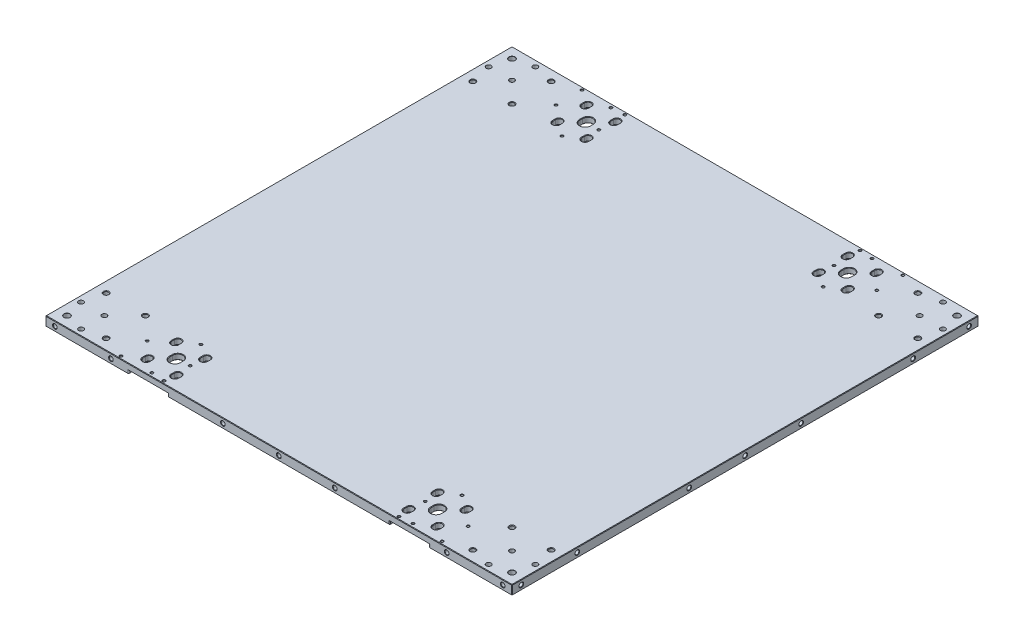
from build123d import *

# Parameters (mm, degrees)
SKETCH1_W                       = 500
SKETCH1_H                       = 500
BOSS_EXTRUDE1_DEPTH             = 10
M3X0_5_TAPPED_HOLE1_AT_2_COUNT  = 2
M3X0_5_TAPPED_HOLE1_AT_2_PITCH  = 46
M3X0_5_TAPPED_HOLE1_AT_3_COUNT  = 2
M3X0_5_TAPPED_HOLE1_AT_3_PITCH  = 53.851648071
M3X0_5_TAPPED_HOLE1_AT_4_COUNT  = 2
M3X0_5_TAPPED_HOLE1_AT_4_PITCH  = 28
M3X0_5_TAPPED_HOLE1_AT_5_COUNT  = 2
M3X0_5_TAPPED_HOLE1_AT_5_PITCH  = 298
M3X0_5_TAPPED_HOLE1_AT_6_COUNT  = 2
M3X0_5_TAPPED_HOLE1_AT_6_PITCH  = 344
M3X0_5_TAPPED_HOLE1_AT_7_COUNT  = 2
M3X0_5_TAPPED_HOLE1_AT_7_PITCH  = 345.137653698
M3X0_5_TAPPED_HOLE1_AT_8_COUNT  = 2
M3X0_5_TAPPED_HOLE1_AT_8_PITCH  = 299.312545678
M3X0_5_TAPPED_HOLE1_AT_9_COUNT  = 2
M3X0_5_TAPPED_HOLE1_AT_9_PITCH  = 553.13651118
M3X0_5_TAPPED_HOLE1_AT_10_COUNT = 2
M3X0_5_TAPPED_HOLE1_AT_10_PITCH = 579.216712466
M3X0_5_TAPPED_HOLE1_AT_11_COUNT = 2
M3X0_5_TAPPED_HOLE1_AT_11_PITCH = 556.938057597
M3X0_5_TAPPED_HOLE1_AT_12_COUNT = 2
M3X0_5_TAPPED_HOLE1_AT_12_PITCH = 529.762210808
M3X0_5_TAPPED_HOLE1_AT_13_COUNT = 2
M3X0_5_TAPPED_HOLE1_AT_13_PITCH = 468.264882305
M3X0_5_TAPPED_HOLE1_AT_14_COUNT = 2
M3X0_5_TAPPED_HOLE1_AT_14_PITCH = 466
M3X0_5_TAPPED_HOLE1_AT_15_COUNT = 2
M3X0_5_TAPPED_HOLE1_AT_15_PITCH = 438
M3X0_5_TAPPED_HOLE1_AT_16_COUNT = 2
M3X0_5_TAPPED_HOLE1_AT_16_PITCH = 440.408900909
M6X1_0_TAPPED_HOLE1_AT_2_COUNT  = 2
M6X1_0_TAPPED_HOLE1_AT_2_PITCH  = 42
M6X1_0_TAPPED_HOLE1_AT_3_COUNT  = 2
M6X1_0_TAPPED_HOLE1_AT_3_PITCH  = 59.39696962
M5X0_8_TAPPED_HOLE1_AT_2_COUNT  = 2
M5X0_8_TAPPED_HOLE1_AT_2_PITCH  = 480
M5X0_8_TAPPED_HOLE1_AT_3_COUNT  = 2
M5X0_8_TAPPED_HOLE1_AT_3_PITCH  = 420
M5X0_8_TAPPED_HOLE1_AT_4_COUNT  = 2
M5X0_8_TAPPED_HOLE1_AT_4_PITCH  = 300
M5X0_8_TAPPED_HOLE1_AT_5_COUNT  = 2
M5X0_8_TAPPED_HOLE1_AT_5_PITCH  = 240
M5X0_8_TAPPED_HOLE1_AT_6_COUNT  = 2
M5X0_8_TAPPED_HOLE1_AT_6_PITCH  = 180
M5X0_8_TAPPED_HOLE1_AT_7_COUNT  = 2
M5X0_8_TAPPED_HOLE1_AT_7_PITCH  = 60
CBORE_FOR_M5_SHCS1_AT_2_COUNT   = 2
CBORE_FOR_M5_SHCS1_AT_2_PITCH   = 35.355339059
CBORE_FOR_M5_SHCS1_AT_3_COUNT   = 2
CBORE_FOR_M5_SHCS1_AT_3_PITCH   = 25
CIRPATTERN1_COUNT               = 4
F_11_0_11_DIAMETER_SLOT1_DEPTH  = 10
F_7_0_7_DIAMETER_SLOT1_DEPTH    = 10
SKETCH16_W                      = 42
SKETCH16_H                      = 65.2
CUT_EXTRUDE1_DEPTH              = 4
M3X0_5_TAPPED_HOLE2_AT_2_COUNT  = 2
M3X0_5_TAPPED_HOLE2_AT_2_PITCH  = 26.25
M3X0_5_TAPPED_HOLE2_AT_3_COUNT  = 2
M3X0_5_TAPPED_HOLE2_AT_3_PITCH  = 26.25
MIRROR2_COPY_3_DEPTH            = 10
MIRROR2_COPY_4_DEPTH            = 10
MIRROR2_COPY_5_SKETCH_W         = 42
MIRROR2_COPY_5_SKETCH_H         = 65.2
MIRROR2_COPY_5_DEPTH            = 4
FILLET2_R                       = 4
FILLET3_R                       = 1
CHAMFER1_SIZE                   = 0.5


# Read off the part's stored shape, not the designer's step: Ø11.0 (11) Diameter Slot1, Ø7.0 (7) Diameter Slot1
with BuildPart() as part:
    # Sketch1 → Boss-Extrude1 (new body)
    with BuildSketch(Plane(origin=(0, 0, 0), x_dir=(1, 0, 0), z_dir=(0, 1, 0))):
        Rectangle(SKETCH1_W, SKETCH1_H)
    extrude(amount=BOSS_EXTRUDE1_DEPTH)

    # Sketch8 → M3x0.5 Tapped Hole1 (revolve, cut)
    with BuildSketch(Plane(origin=(172, 10, 219), x_dir=(0, 0, 1), z_dir=(1, 0, 0))):
        Polygon((0, 0), (0, 10), (1.525, 10), (1.25, 9.725), (1.25, 0.275), (1.525, 0), align=None)
    m3x0_5_tapped_hole1 = revolve(axis=Axis((172, 16.35, 219), (0, -1, 0)), mode=Mode.SUBTRACT)

    # M3x0.5 Tapped Hole1 at 2: M3x0.5 Tapped Hole1 ×2
    with Locations(*[(-i * M3X0_5_TAPPED_HOLE1_AT_2_PITCH, 0, 0) for i in range(1, M3X0_5_TAPPED_HOLE1_AT_2_COUNT)]):
        add(m3x0_5_tapped_hole1, mode=Mode.SUBTRACT)

    # M3x0.5 Tapped Hole1 at 3: M3x0.5 Tapped Hole1 ×2
    with Locations(*[Vector(-0.8541985556144385, 0, 0.5199469468957455) * (i * M3X0_5_TAPPED_HOLE1_AT_3_PITCH) for i in range(1, M3X0_5_TAPPED_HOLE1_AT_3_COUNT)]):
        add(m3x0_5_tapped_hole1, mode=Mode.SUBTRACT)

    # M3x0.5 Tapped Hole1 at 4: M3x0.5 Tapped Hole1 ×2
    with Locations(*[(0, 0, i * M3X0_5_TAPPED_HOLE1_AT_4_PITCH) for i in range(1, M3X0_5_TAPPED_HOLE1_AT_4_COUNT)]):
        add(m3x0_5_tapped_hole1, mode=Mode.SUBTRACT)

    # M3x0.5 Tapped Hole1 at 5: M3x0.5 Tapped Hole1 ×2
    with Locations(*[(-i * M3X0_5_TAPPED_HOLE1_AT_5_PITCH, 0, 0) for i in range(1, M3X0_5_TAPPED_HOLE1_AT_5_COUNT)]):
        add(m3x0_5_tapped_hole1, mode=Mode.SUBTRACT)

    # M3x0.5 Tapped Hole1 at 6: M3x0.5 Tapped Hole1 ×2
    with Locations(*[(-i * M3X0_5_TAPPED_HOLE1_AT_6_PITCH, 0, 0) for i in range(1, M3X0_5_TAPPED_HOLE1_AT_6_COUNT)]):
        add(m3x0_5_tapped_hole1, mode=Mode.SUBTRACT)

    # M3x0.5 Tapped Hole1 at 7: M3x0.5 Tapped Hole1 ×2
    with Locations(*[Vector(-0.9967037682339824, 0, 0.081127050902766) * (i * M3X0_5_TAPPED_HOLE1_AT_7_PITCH) for i in range(1, M3X0_5_TAPPED_HOLE1_AT_7_COUNT)]):
        add(m3x0_5_tapped_hole1, mode=Mode.SUBTRACT)

    # M3x0.5 Tapped Hole1 at 8: M3x0.5 Tapped Hole1 ×2
    with Locations(*[Vector(-0.995614798990067, 0, 0.09354769923396598) * (i * M3X0_5_TAPPED_HOLE1_AT_8_PITCH) for i in range(1, M3X0_5_TAPPED_HOLE1_AT_8_COUNT)]):
        add(m3x0_5_tapped_hole1, mode=Mode.SUBTRACT)

    # M3x0.5 Tapped Hole1 at 9: M3x0.5 Tapped Hole1 ×2
    with Locations(*[Vector(-0.5387458502142013, 0, -0.8424683429524088) * (i * M3X0_5_TAPPED_HOLE1_AT_9_PITCH) for i in range(1, M3X0_5_TAPPED_HOLE1_AT_9_COUNT)]):
        add(m3x0_5_tapped_hole1, mode=Mode.SUBTRACT)

    # M3x0.5 Tapped Hole1 at 10: M3x0.5 Tapped Hole1 ×2
    with Locations(*[Vector(-0.5939055151488782, 0, -0.8045347966842364) * (i * M3X0_5_TAPPED_HOLE1_AT_10_PITCH) for i in range(1, M3X0_5_TAPPED_HOLE1_AT_10_COUNT)]):
        add(m3x0_5_tapped_hole1, mode=Mode.SUBTRACT)

    # M3x0.5 Tapped Hole1 at 11: M3x0.5 Tapped Hole1 ×2
    with Locations(*[Vector(-0.6176629434953669, 0, -0.7864429338691011) * (i * M3X0_5_TAPPED_HOLE1_AT_11_PITCH) for i in range(1, M3X0_5_TAPPED_HOLE1_AT_11_COUNT)]):
        add(m3x0_5_tapped_hole1, mode=Mode.SUBTRACT)

    # M3x0.5 Tapped Hole1 at 12: M3x0.5 Tapped Hole1 ×2
    with Locations(*[Vector(-0.5625165289641595, 0, -0.8267860392157781) * (i * M3X0_5_TAPPED_HOLE1_AT_12_PITCH) for i in range(1, M3X0_5_TAPPED_HOLE1_AT_12_COUNT)]):
        add(m3x0_5_tapped_hole1, mode=Mode.SUBTRACT)

    # M3x0.5 Tapped Hole1 at 13: M3x0.5 Tapped Hole1 ×2
    with Locations(*[Vector(-0.09823499847688853, 0, -0.995163245439785) * (i * M3X0_5_TAPPED_HOLE1_AT_13_PITCH) for i in range(1, M3X0_5_TAPPED_HOLE1_AT_13_COUNT)]):
        add(m3x0_5_tapped_hole1, mode=Mode.SUBTRACT)

    # M3x0.5 Tapped Hole1 at 14: M3x0.5 Tapped Hole1 ×2
    with Locations(*[(0, 0, -i * M3X0_5_TAPPED_HOLE1_AT_14_PITCH) for i in range(1, M3X0_5_TAPPED_HOLE1_AT_14_COUNT)]):
        add(m3x0_5_tapped_hole1, mode=Mode.SUBTRACT)

    # M3x0.5 Tapped Hole1 at 15: M3x0.5 Tapped Hole1 ×2
    with Locations(*[(0, 0, -i * M3X0_5_TAPPED_HOLE1_AT_15_PITCH) for i in range(1, M3X0_5_TAPPED_HOLE1_AT_15_COUNT)]):
        add(m3x0_5_tapped_hole1, mode=Mode.SUBTRACT)

    # M3x0.5 Tapped Hole1 at 16: M3x0.5 Tapped Hole1 ×2
    with Locations(*[Vector(-0.10444838854310472, 0, -0.9945303083017374) * (i * M3X0_5_TAPPED_HOLE1_AT_16_PITCH) for i in range(1, M3X0_5_TAPPED_HOLE1_AT_16_COUNT)]):
        add(m3x0_5_tapped_hole1, mode=Mode.SUBTRACT)

    # Sketch6 → M6x1.0 Tapped Hole1 (revolve, cut)
    with BuildSketch(Plane(origin=(196.5, 10, 238.5), x_dir=(0, 0, 1), z_dir=(1, 0, 0))):
        Polygon((0, 0), (0, 10), (3.025, 10), (2.5, 9.475), (2.5, 0.525), (3.025, 0), align=None)
    m6x1_0_tapped_hole1 = revolve(axis=Axis((196.5, 16.35, 238.5), (0, -1, 0)), mode=Mode.SUBTRACT)

    # M6x1.0 Tapped Hole1 at 2: M6x1.0 Tapped Hole1 ×2
    with Locations(*[(0, 0, -i * M6X1_0_TAPPED_HOLE1_AT_2_PITCH) for i in range(1, M6X1_0_TAPPED_HOLE1_AT_2_COUNT)]):
        add(m6x1_0_tapped_hole1, mode=Mode.SUBTRACT)

    # M6x1.0 Tapped Hole1 at 3: M6x1.0 Tapped Hole1 ×2
    with Locations(*[Vector(0.7071067811865474, 0, -0.7071067811865478) * (i * M6X1_0_TAPPED_HOLE1_AT_3_PITCH) for i in range(1, M6X1_0_TAPPED_HOLE1_AT_3_COUNT)]):
        add(m6x1_0_tapped_hole1, mode=Mode.SUBTRACT)

    # Sketch23 → M6 Clearance Hole1 (revolve, cut)
    with BuildSketch(Plane(origin=(238.5, 10, 238.5), x_dir=(0, 0, 1), z_dir=(1, 0, 0))):
        Polygon((0, 0), (0, 10), (3.325, 10), (3.2, 9.875), (3.2, 0.125), (3.325, 0), align=None)
    m6_clearance_hole1 = revolve(axis=Axis((238.5, 16.35, 238.5), (0, -1, 0)), mode=Mode.SUBTRACT)

    # Sketch21 → M5x0.8 Tapped Hole1 (revolve, cut)
    with BuildSketch(Plane(origin=(240, 5, 250), x_dir=(0, -1, 0), z_dir=(1, 0, 0))):
        Polygon((0, 0), (0, 8.6618073), (2.1, 7.4), (2.1, 0.425), (2.525, 0), align=None)
    m5x0_8_tapped_hole1 = revolve(axis=Axis((240, 5, 256.35), (0, 0, -1)), mode=Mode.SUBTRACT)

    # M5x0.8 Tapped Hole1 at 2: M5x0.8 Tapped Hole1 ×2
    with Locations(*[(-i * M5X0_8_TAPPED_HOLE1_AT_2_PITCH, 0, 0) for i in range(1, M5X0_8_TAPPED_HOLE1_AT_2_COUNT)]):
        add(m5x0_8_tapped_hole1, mode=Mode.SUBTRACT)

    # M5x0.8 Tapped Hole1 at 3: M5x0.8 Tapped Hole1 ×2
    with Locations(*[(-i * M5X0_8_TAPPED_HOLE1_AT_3_PITCH, 0, 0) for i in range(1, M5X0_8_TAPPED_HOLE1_AT_3_COUNT)]):
        add(m5x0_8_tapped_hole1, mode=Mode.SUBTRACT)

    # M5x0.8 Tapped Hole1 at 4: M5x0.8 Tapped Hole1 ×2
    with Locations(*[(-i * M5X0_8_TAPPED_HOLE1_AT_4_PITCH, 0, 0) for i in range(1, M5X0_8_TAPPED_HOLE1_AT_4_COUNT)]):
        add(m5x0_8_tapped_hole1, mode=Mode.SUBTRACT)

    # M5x0.8 Tapped Hole1 at 5: M5x0.8 Tapped Hole1 ×2
    with Locations(*[(-i * M5X0_8_TAPPED_HOLE1_AT_5_PITCH, 0, 0) for i in range(1, M5X0_8_TAPPED_HOLE1_AT_5_COUNT)]):
        add(m5x0_8_tapped_hole1, mode=Mode.SUBTRACT)

    # M5x0.8 Tapped Hole1 at 6: M5x0.8 Tapped Hole1 ×2
    with Locations(*[(-i * M5X0_8_TAPPED_HOLE1_AT_6_PITCH, 0, 0) for i in range(1, M5X0_8_TAPPED_HOLE1_AT_6_COUNT)]):
        add(m5x0_8_tapped_hole1, mode=Mode.SUBTRACT)

    # M5x0.8 Tapped Hole1 at 7: M5x0.8 Tapped Hole1 ×2
    with Locations(*[(-i * M5X0_8_TAPPED_HOLE1_AT_7_PITCH, 0, 0) for i in range(1, M5X0_8_TAPPED_HOLE1_AT_7_COUNT)]):
        add(m5x0_8_tapped_hole1, mode=Mode.SUBTRACT)

    # Sketch25 → CBORE for M5 SHCS1 (revolve, cut)
    with BuildSketch(Plane(origin=(243.45, 0, 218.45), x_dir=(0, 0, -1), z_dir=(1, 0, 0))):
        Polygon((0, 0), (0, 10), (2.65, 10), (2.65, 5), (5, 5), (5, 0.5), (5.5, 0), align=None)
    cbore_for_m5_shcs1 = revolve(axis=Axis((243.45, -6.35, 218.45), (0, 1, 0)), mode=Mode.SUBTRACT)

    # CBORE for M5 SHCS1 at 2: CBORE for M5 SHCS1 ×2
    with Locations(*[Vector(-0.7071067811865476, 0, 0.7071067811865476) * (i * CBORE_FOR_M5_SHCS1_AT_2_PITCH) for i in range(1, CBORE_FOR_M5_SHCS1_AT_2_COUNT)]):
        add(cbore_for_m5_shcs1, mode=Mode.SUBTRACT)

    # CBORE for M5 SHCS1 at 3: CBORE for M5 SHCS1 ×2
    with Locations(*[(-i * CBORE_FOR_M5_SHCS1_AT_3_PITCH, 0, 0) for i in range(1, CBORE_FOR_M5_SHCS1_AT_3_COUNT)]):
        add(cbore_for_m5_shcs1, mode=Mode.SUBTRACT)

    # CirPattern1: M6x1.0 Tapped Hole1, M6 Clearance Hole1, M5x0.8 Tapped Hole1, CBORE for M5 SHCS1 ×4 about axis
    cirpattern1_axis = Axis((0, 0, 0), (0, 1, 0))
    add([m6x1_0_tapped_hole1.rotate(cirpattern1_axis, i * 360 / CIRPATTERN1_COUNT) for i in range(1, CIRPATTERN1_COUNT)], mode=Mode.SUBTRACT)
    add([m6_clearance_hole1.rotate(cirpattern1_axis, i * 360 / CIRPATTERN1_COUNT) for i in range(1, CIRPATTERN1_COUNT)], mode=Mode.SUBTRACT)
    add([m5x0_8_tapped_hole1.rotate(cirpattern1_axis, i * 360 / CIRPATTERN1_COUNT) for i in range(1, CIRPATTERN1_COUNT)], mode=Mode.SUBTRACT)
    add([cbore_for_m5_shcs1.rotate(cirpattern1_axis, i * 360 / CIRPATTERN1_COUNT) for i in range(1, CIRPATTERN1_COUNT)], mode=Mode.SUBTRACT)

    # CirPattern1 copy 1 sketch → CirPattern1 copy 1 (revolve, cut)
    with BuildSketch(Plane(origin=(196.5, 10, -196.5), x_dir=(1, 0, 0), z_dir=(0, 0, -1))):
        Polygon((0, 0), (0, 10), (3.025, 10), (2.5, 9.475), (2.5, 0.525), (3.025, 0), align=None)
    revolve(axis=Axis((196.5, 16.35, -196.5), (0, -1, 0)), mode=Mode.SUBTRACT)

    # CirPattern1 copy 2 sketch → CirPattern1 copy 2 (revolve, cut)
    with BuildSketch(Plane(origin=(-196.5, 10, -196.5), x_dir=(0, 0, -1), z_dir=(-1, 0, 0))):
        Polygon((0, 0), (0, 10), (3.025, 10), (2.5, 9.475), (2.5, 0.525), (3.025, 0), align=None)
    revolve(axis=Axis((-196.5, 16.35, -196.5), (0, -1, 0)), mode=Mode.SUBTRACT)

    # CirPattern1 copy 3 sketch → CirPattern1 copy 3 (revolve, cut)
    with BuildSketch(Plane(origin=(-196.5, 10, 196.5), x_dir=(-1, 0, 0), z_dir=(0, 0, 1))):
        Polygon((0, 0), (0, 10), (3.025, 10), (2.5, 9.475), (2.5, 0.525), (3.025, 0), align=None)
    revolve(axis=Axis((-196.5, 16.35, 196.5), (0, -1, 0)), mode=Mode.SUBTRACT)

    # CirPattern1 copy 4 sketch → CirPattern1 copy 4 (revolve, cut)
    with BuildSketch(Plane(origin=(196.5, 10, -238.5), x_dir=(1, 0, 0), z_dir=(0, 0, -1))):
        Polygon((0, 0), (0, 10), (3.025, 10), (2.5, 9.475), (2.5, 0.525), (3.025, 0), align=None)
    revolve(axis=Axis((196.5, 16.35, -238.5), (0, -1, 0)), mode=Mode.SUBTRACT)

    # CirPattern1 copy 5 sketch → CirPattern1 copy 5 (revolve, cut)
    with BuildSketch(Plane(origin=(-238.5, 10, -196.5), x_dir=(0, 0, -1), z_dir=(-1, 0, 0))):
        Polygon((0, 0), (0, 10), (3.025, 10), (2.5, 9.475), (2.5, 0.525), (3.025, 0), align=None)
    revolve(axis=Axis((-238.5, 16.35, -196.5), (0, -1, 0)), mode=Mode.SUBTRACT)

    # CirPattern1 copy 6 sketch → CirPattern1 copy 6 (revolve, cut)
    with BuildSketch(Plane(origin=(-196.5, 10, 238.5), x_dir=(-1, 0, 0), z_dir=(0, 0, 1))):
        Polygon((0, 0), (0, 10), (3.025, 10), (2.5, 9.475), (2.5, 0.525), (3.025, 0), align=None)
    revolve(axis=Axis((-196.5, 16.35, 238.5), (0, -1, 0)), mode=Mode.SUBTRACT)

    # CirPattern1 copy 7 sketch → CirPattern1 copy 7 (revolve, cut)
    with BuildSketch(Plane(origin=(250, 5, 240), x_dir=(0, -1, 0), z_dir=(0, 0, -1))):
        Polygon((0, 0), (0, 8.6618073), (2.1, 7.4), (2.1, 0.425), (2.525, 0), align=None)
    revolve(axis=Axis((256.35, 5, 240), (-1, 0, 0)), mode=Mode.SUBTRACT)

    # CirPattern1 copy 8 sketch → CirPattern1 copy 8 (revolve, cut)
    with BuildSketch(Plane(origin=(240, 5, -250), x_dir=(0, -1, 0), z_dir=(-1, 0, 0))):
        Polygon((0, 0), (0, 8.6618073), (2.1, 7.4), (2.1, 0.425), (2.525, 0), align=None)
    revolve(axis=Axis((240, 5, -256.35), (0, 0, 1)), mode=Mode.SUBTRACT)

    # CirPattern1 copy 9 sketch → CirPattern1 copy 9 (revolve, cut)
    with BuildSketch(Plane(origin=(-250, 5, -240), x_dir=(0, -1, 0), z_dir=(0, 0, 1))):
        Polygon((0, 0), (0, 8.6618073), (2.1, 7.4), (2.1, 0.425), (2.525, 0), align=None)
    revolve(axis=Axis((-256.35, 5, -240), (1, 0, 0)), mode=Mode.SUBTRACT)

    # CirPattern1 copy 10 sketch → CirPattern1 copy 10 (revolve, cut)
    with BuildSketch(Plane(origin=(250, 5, 180), x_dir=(0, -1, 0), z_dir=(0, 0, -1))):
        Polygon((0, 0), (0, 8.6618073), (2.1, 7.4), (2.1, 0.425), (2.525, 0), align=None)
    revolve(axis=Axis((256.35, 5, 180), (-1, 0, 0)), mode=Mode.SUBTRACT)

    # CirPattern1 copy 11 sketch → CirPattern1 copy 11 (revolve, cut)
    with BuildSketch(Plane(origin=(180, 5, -250), x_dir=(0, -1, 0), z_dir=(-1, 0, 0))):
        Polygon((0, 0), (0, 8.6618073), (2.1, 7.4), (2.1, 0.425), (2.525, 0), align=None)
    revolve(axis=Axis((180, 5, -256.35), (0, 0, 1)), mode=Mode.SUBTRACT)

    # CirPattern1 copy 12 sketch → CirPattern1 copy 12 (revolve, cut)
    with BuildSketch(Plane(origin=(-250, 5, -180), x_dir=(0, -1, 0), z_dir=(0, 0, 1))):
        Polygon((0, 0), (0, 8.6618073), (2.1, 7.4), (2.1, 0.425), (2.525, 0), align=None)
    revolve(axis=Axis((-256.35, 5, -180), (1, 0, 0)), mode=Mode.SUBTRACT)

    # CirPattern1 copy 13 sketch → CirPattern1 copy 13 (revolve, cut)
    with BuildSketch(Plane(origin=(250, 5, 60), x_dir=(0, -1, 0), z_dir=(0, 0, -1))):
        Polygon((0, 0), (0, 8.6618073), (2.1, 7.4), (2.1, 0.425), (2.525, 0), align=None)
    revolve(axis=Axis((256.35, 5, 60), (-1, 0, 0)), mode=Mode.SUBTRACT)

    # CirPattern1 copy 14 sketch → CirPattern1 copy 14 (revolve, cut)
    with BuildSketch(Plane(origin=(60, 5, -250), x_dir=(0, -1, 0), z_dir=(-1, 0, 0))):
        Polygon((0, 0), (0, 8.6618073), (2.1, 7.4), (2.1, 0.425), (2.525, 0), align=None)
    revolve(axis=Axis((60, 5, -256.35), (0, 0, 1)), mode=Mode.SUBTRACT)

    # CirPattern1 copy 15 sketch → CirPattern1 copy 15 (revolve, cut)
    with BuildSketch(Plane(origin=(-250, 5, -60), x_dir=(0, -1, 0), z_dir=(0, 0, 1))):
        Polygon((0, 0), (0, 8.6618073), (2.1, 7.4), (2.1, 0.425), (2.525, 0), align=None)
    revolve(axis=Axis((-256.35, 5, -60), (1, 0, 0)), mode=Mode.SUBTRACT)

    # CirPattern1 copy 16 sketch → CirPattern1 copy 16 (revolve, cut)
    with BuildSketch(Plane(origin=(250, 5, 0), x_dir=(0, -1, 0), z_dir=(0, 0, -1))):
        Polygon((0, 0), (0, 8.6618073), (2.1, 7.4), (2.1, 0.425), (2.525, 0), align=None)
    revolve(axis=Axis((256.35, 5, 0), (-1, 0, 0)), mode=Mode.SUBTRACT)

    # CirPattern1 copy 17 sketch → CirPattern1 copy 17 (revolve, cut)
    with BuildSketch(Plane(origin=(0, 5, -250), x_dir=(0, -1, 0), z_dir=(-1, 0, 0))):
        Polygon((0, 0), (0, 8.6618073), (2.1, 7.4), (2.1, 0.425), (2.525, 0), align=None)
    revolve(axis=Axis((0, 5, -256.35), (0, 0, 1)), mode=Mode.SUBTRACT)

    # CirPattern1 copy 18 sketch → CirPattern1 copy 18 (revolve, cut)
    with BuildSketch(Plane(origin=(-250, 5, 0), x_dir=(0, -1, 0), z_dir=(0, 0, 1))):
        Polygon((0, 0), (0, 8.6618073), (2.1, 7.4), (2.1, 0.425), (2.525, 0), align=None)
    revolve(axis=Axis((-256.35, 5, 0), (1, 0, 0)), mode=Mode.SUBTRACT)

    # CirPattern1 copy 19 sketch → CirPattern1 copy 19 (revolve, cut)
    with BuildSketch(Plane(origin=(250, 5, -60), x_dir=(0, -1, 0), z_dir=(0, 0, -1))):
        Polygon((0, 0), (0, 8.6618073), (2.1, 7.4), (2.1, 0.425), (2.525, 0), align=None)
    revolve(axis=Axis((256.35, 5, -60), (-1, 0, 0)), mode=Mode.SUBTRACT)

    # CirPattern1 copy 20 sketch → CirPattern1 copy 20 (revolve, cut)
    with BuildSketch(Plane(origin=(-60, 5, -250), x_dir=(0, -1, 0), z_dir=(-1, 0, 0))):
        Polygon((0, 0), (0, 8.6618073), (2.1, 7.4), (2.1, 0.425), (2.525, 0), align=None)
    revolve(axis=Axis((-60, 5, -256.35), (0, 0, 1)), mode=Mode.SUBTRACT)

    # CirPattern1 copy 21 sketch → CirPattern1 copy 21 (revolve, cut)
    with BuildSketch(Plane(origin=(-250, 5, 60), x_dir=(0, -1, 0), z_dir=(0, 0, 1))):
        Polygon((0, 0), (0, 8.6618073), (2.1, 7.4), (2.1, 0.425), (2.525, 0), align=None)
    revolve(axis=Axis((-256.35, 5, 60), (1, 0, 0)), mode=Mode.SUBTRACT)

    # CirPattern1 copy 22 sketch → CirPattern1 copy 22 (revolve, cut)
    with BuildSketch(Plane(origin=(250, 5, -180), x_dir=(0, -1, 0), z_dir=(0, 0, -1))):
        Polygon((0, 0), (0, 8.6618073), (2.1, 7.4), (2.1, 0.425), (2.525, 0), align=None)
    revolve(axis=Axis((256.35, 5, -180), (-1, 0, 0)), mode=Mode.SUBTRACT)

    # CirPattern1 copy 23 sketch → CirPattern1 copy 23 (revolve, cut)
    with BuildSketch(Plane(origin=(-180, 5, -250), x_dir=(0, -1, 0), z_dir=(-1, 0, 0))):
        Polygon((0, 0), (0, 8.6618073), (2.1, 7.4), (2.1, 0.425), (2.525, 0), align=None)
    revolve(axis=Axis((-180, 5, -256.35), (0, 0, 1)), mode=Mode.SUBTRACT)

    # CirPattern1 copy 24 sketch → CirPattern1 copy 24 (revolve, cut)
    with BuildSketch(Plane(origin=(-250, 5, 180), x_dir=(0, -1, 0), z_dir=(0, 0, 1))):
        Polygon((0, 0), (0, 8.6618073), (2.1, 7.4), (2.1, 0.425), (2.525, 0), align=None)
    revolve(axis=Axis((-256.35, 5, 180), (1, 0, 0)), mode=Mode.SUBTRACT)

    # CirPattern1 copy 25 sketch → CirPattern1 copy 25 (revolve, cut)
    with BuildSketch(Plane(origin=(243.45, 0, -218.45), x_dir=(-1, 0, 0), z_dir=(0, 0, -1))):
        Polygon((0, 0), (0, 10), (2.65, 10), (2.65, 5), (5, 5), (5, 0.5), (5.5, 0), align=None)
    revolve(axis=Axis((243.45, -6.35, -218.45), (0, 1, 0)), mode=Mode.SUBTRACT)

    # CirPattern1 copy 26 sketch → CirPattern1 copy 26 (revolve, cut)
    with BuildSketch(Plane(origin=(-218.45, 0, -243.45), x_dir=(0, 0, 1), z_dir=(-1, 0, 0))):
        Polygon((0, 0), (0, 10), (2.65, 10), (2.65, 5), (5, 5), (5, 0.5), (5.5, 0), align=None)
    revolve(axis=Axis((-218.45, -6.35, -243.45), (0, 1, 0)), mode=Mode.SUBTRACT)

    # CirPattern1 copy 27 sketch → CirPattern1 copy 27 (revolve, cut)
    with BuildSketch(Plane(origin=(-243.45, 0, 218.45), x_dir=(1, 0, 0), z_dir=(0, 0, 1))):
        Polygon((0, 0), (0, 10), (2.65, 10), (2.65, 5), (5, 5), (5, 0.5), (5.5, 0), align=None)
    revolve(axis=Axis((-243.45, -6.35, 218.45), (0, 1, 0)), mode=Mode.SUBTRACT)

    # CirPattern1 copy 28 sketch → CirPattern1 copy 28 (revolve, cut)
    with BuildSketch(Plane(origin=(218.45, 0, -218.45), x_dir=(-1, 0, 0), z_dir=(0, 0, -1))):
        Polygon((0, 0), (0, 10), (2.65, 10), (2.65, 5), (5, 5), (5, 0.5), (5.5, 0), align=None)
    revolve(axis=Axis((218.45, -6.35, -218.45), (0, 1, 0)), mode=Mode.SUBTRACT)

    # CirPattern1 copy 29 sketch → CirPattern1 copy 29 (revolve, cut)
    with BuildSketch(Plane(origin=(-218.45, 0, -218.45), x_dir=(0, 0, 1), z_dir=(-1, 0, 0))):
        Polygon((0, 0), (0, 10), (2.65, 10), (2.65, 5), (5, 5), (5, 0.5), (5.5, 0), align=None)
    revolve(axis=Axis((-218.45, -6.35, -218.45), (0, 1, 0)), mode=Mode.SUBTRACT)

    # CirPattern1 copy 30 sketch → CirPattern1 copy 30 (revolve, cut)
    with BuildSketch(Plane(origin=(-218.45, 0, 218.45), x_dir=(1, 0, 0), z_dir=(0, 0, 1))):
        Polygon((0, 0), (0, 10), (2.65, 10), (2.65, 5), (5, 5), (5, 0.5), (5.5, 0), align=None)
    revolve(axis=Axis((-218.45, -6.35, 218.45), (0, 1, 0)), mode=Mode.SUBTRACT)

    # Ø11.0 (11) Diameter Slot1 outline → Ø11.0 (11) Diameter Slot1 (cut)
    with BuildSketch(Plane(origin=(0, 0, 0), x_dir=(1, 0, 0), z_dir=(0, 1, 0))):
        with BuildLine():
            Line((-134.5, -221.3), (-134.5, -218.3))
            ThreePointArc((-134.5, -218.3), (-140, -212.8), (-145.5, -218.3))
            Line((-145.5, -218.3), (-145.5, -221.3))
            ThreePointArc((-145.5, -221.3), (-140, -226.8), (-134.5, -221.3))
        make_face()
    f_11_0_11_diameter_slot1 = extrude(amount=F_11_0_11_DIAMETER_SLOT1_DEPTH, mode=Mode.SUBTRACT)

    # Ø7.0 (7) Diameter Slot1 outline → Ø7.0 (7) Diameter Slot1 (cut)
    with BuildSketch(Plane(origin=(0, 0, 0), x_dir=(1, 0, 0), z_dir=(0, 1, 0))):
        with BuildLine():
            Line((-152, -236.8), (-152, -233.8))
            ThreePointArc((-152, -233.8), (-155.5, -230.3), (-159, -233.8))
            Line((-159, -233.8), (-159, -236.8))
            ThreePointArc((-159, -236.8), (-155.5, -240.3), (-152, -236.8))
        make_face()
        with BuildLine():
            ThreePointArc((-152, -202.8), (-155.5, -199.3), (-159, -202.8))
            Line((-159, -202.8), (-159, -205.8))
            ThreePointArc((-159, -205.8), (-155.5, -209.3), (-152, -205.8))
            Line((-152, -205.8), (-152, -202.8))
        make_face()
        with BuildLine():
            Line((-121, -205.8), (-121, -202.8))
            ThreePointArc((-121, -202.8), (-124.5, -199.3), (-128, -202.8))
            Line((-128, -202.8), (-128, -205.8))
            ThreePointArc((-128, -205.8), (-124.5, -209.3), (-121, -205.8))
        make_face()
        with BuildLine():
            ThreePointArc((-121, -233.8), (-124.5, -230.3), (-128, -233.8))
            Line((-128, -233.8), (-128, -236.8))
            ThreePointArc((-128, -236.8), (-124.5, -240.3), (-121, -236.8))
            Line((-121, -236.8), (-121, -233.8))
        make_face()
    f_7_0_7_diameter_slot1 = extrude(amount=F_7_0_7_DIAMETER_SLOT1_DEPTH, mode=Mode.SUBTRACT)

    # Sketch16 → Cut-Extrude1 (cut)
    with BuildSketch(Plane.XZ):
        with Locations((-140, 217.4)):
            Rectangle(SKETCH16_W, SKETCH16_H)
    cut_extrude1 = extrude(amount=-CUT_EXTRUDE1_DEPTH, mode=Mode.SUBTRACT)

    # Sketch18 → M3x0.5 Tapped Hole2 (revolve, cut)
    with BuildSketch(Plane(origin=(-140, 4, 219.8), x_dir=(0, 0, -1), z_dir=(1, 0, 0))):
        Polygon((0, 0), (0, 6), (1.525, 6), (1.25, 5.725), (1.25, 0.275), (1.525, 0), align=None)
    m3x0_5_tapped_hole2 = revolve(axis=Axis((-140, -2.35, 219.8), (0, 1, 0)), mode=Mode.SUBTRACT)

    # M3x0.5 Tapped Hole2 at 2: M3x0.5 Tapped Hole2 ×2
    with Locations(*[(0, 0, -i * M3X0_5_TAPPED_HOLE2_AT_2_PITCH) for i in range(1, M3X0_5_TAPPED_HOLE2_AT_2_COUNT)]):
        add(m3x0_5_tapped_hole2, mode=Mode.SUBTRACT)

    # M3x0.5 Tapped Hole2 at 3: M3x0.5 Tapped Hole2 ×2
    with Locations(*[(0, 0, i * M3X0_5_TAPPED_HOLE2_AT_3_PITCH) for i in range(1, M3X0_5_TAPPED_HOLE2_AT_3_COUNT)]):
        add(m3x0_5_tapped_hole2, mode=Mode.SUBTRACT)

    # Mirror1: Ø11.0 (11) Diameter Slot1, Ø7.0 (7) Diameter Slot1, Cut-Extrude1, M3x0.5 Tapped Hole2 across plane
    add(f_11_0_11_diameter_slot1.mirror(Plane(origin=(0, 0, 0), x_dir=(0, 0, 1), z_dir=(1, 0, 0))), mode=Mode.SUBTRACT)
    add(f_7_0_7_diameter_slot1.mirror(Plane(origin=(0, 0, 0), x_dir=(0, 0, 1), z_dir=(1, 0, 0))), mode=Mode.SUBTRACT)
    add(cut_extrude1.mirror(Plane(origin=(0, 0, 0), x_dir=(0, 0, 1), z_dir=(1, 0, 0))), mode=Mode.SUBTRACT)
    add(m3x0_5_tapped_hole2.mirror(Plane(origin=(0, 0, 0), x_dir=(0, 0, 1), z_dir=(1, 0, 0))), mode=Mode.SUBTRACT)

    # Mirror1 copy 1 sketch → Mirror1 copy 1 (revolve, cut)
    with BuildSketch(Plane(origin=(140, 4, 193.55), x_dir=(0, 0, -1), z_dir=(-1, 0, 0))):
        Polygon((0, 0), (0, -6), (1.525, -6), (1.25, -5.725), (1.25, -0.275), (1.525, 0), align=None)
    revolve(axis=Axis((140, -2.35, 193.55), (0, -1, 0)), mode=Mode.SUBTRACT)

    # Mirror1 copy 2 sketch → Mirror1 copy 2 (revolve, cut)
    with BuildSketch(Plane(origin=(140, 4, 246.05), x_dir=(0, 0, -1), z_dir=(-1, 0, 0))):
        Polygon((0, 0), (0, -6), (1.525, -6), (1.25, -5.725), (1.25, -0.275), (1.525, 0), align=None)
    revolve(axis=Axis((140, -2.35, 246.05), (0, -1, 0)), mode=Mode.SUBTRACT)

    # Mirror2: Ø11.0 (11) Diameter Slot1, Ø7.0 (7) Diameter Slot1, Cut-Extrude1, M3x0.5 Tapped Hole2 across plane
    add(f_11_0_11_diameter_slot1.mirror(Plane.XY), mode=Mode.SUBTRACT)
    add(f_7_0_7_diameter_slot1.mirror(Plane.XY), mode=Mode.SUBTRACT)
    add(cut_extrude1.mirror(Plane.XY), mode=Mode.SUBTRACT)
    add(m3x0_5_tapped_hole2.mirror(Plane.XY), mode=Mode.SUBTRACT)

    # Mirror2 copy 1 sketch → Mirror2 copy 1 (revolve, cut)
    with BuildSketch(Plane(origin=(-140, 4, -193.55), x_dir=(0, 0, 1), z_dir=(1, 0, 0))):
        Polygon((0, 0), (0, -6), (1.525, -6), (1.25, -5.725), (1.25, -0.275), (1.525, 0), align=None)
    revolve(axis=Axis((-140, -2.35, -193.55), (0, -1, 0)), mode=Mode.SUBTRACT)

    # Mirror2 copy 2 sketch → Mirror2 copy 2 (revolve, cut)
    with BuildSketch(Plane(origin=(-140, 4, -246.05), x_dir=(0, 0, 1), z_dir=(1, 0, 0))):
        Polygon((0, 0), (0, -6), (1.525, -6), (1.25, -5.725), (1.25, -0.275), (1.525, 0), align=None)
    revolve(axis=Axis((-140, -2.35, -246.05), (0, -1, 0)), mode=Mode.SUBTRACT)

    # Mirror2 copy 3 sketch → Mirror2 copy 3 (cut)
    with BuildSketch(Plane(origin=(0, 0, 0), x_dir=(-1, 0, 0), z_dir=(0, 1, 0))):
        with BuildLine():
            Line((-134.5, -221.3), (-134.5, -218.3))
            ThreePointArc((-134.5, -218.3), (-140, -212.8), (-145.5, -218.3))
            Line((-145.5, -218.3), (-145.5, -221.3))
            ThreePointArc((-145.5, -221.3), (-140, -226.8), (-134.5, -221.3))
        make_face()
    extrude(amount=MIRROR2_COPY_3_DEPTH, mode=Mode.SUBTRACT)

    # Mirror2 copy 4 sketch → Mirror2 copy 4 (cut)
    with BuildSketch(Plane(origin=(0, 0, 0), x_dir=(-1, 0, 0), z_dir=(0, 1, 0))):
        with BuildLine():
            Line((-152, -236.8), (-152, -233.8))
            ThreePointArc((-152, -233.8), (-155.5, -230.3), (-159, -233.8))
            Line((-159, -233.8), (-159, -236.8))
            ThreePointArc((-159, -236.8), (-155.5, -240.3), (-152, -236.8))
        make_face()
        with BuildLine():
            ThreePointArc((-152, -202.8), (-155.5, -199.3), (-159, -202.8))
            Line((-159, -202.8), (-159, -205.8))
            ThreePointArc((-159, -205.8), (-155.5, -209.3), (-152, -205.8))
            Line((-152, -205.8), (-152, -202.8))
        make_face()
        with BuildLine():
            Line((-121, -205.8), (-121, -202.8))
            ThreePointArc((-121, -202.8), (-124.5, -199.3), (-128, -202.8))
            Line((-128, -202.8), (-128, -205.8))
            ThreePointArc((-128, -205.8), (-124.5, -209.3), (-121, -205.8))
        make_face()
        with BuildLine():
            ThreePointArc((-121, -233.8), (-124.5, -230.3), (-128, -233.8))
            Line((-128, -233.8), (-128, -236.8))
            ThreePointArc((-128, -236.8), (-124.5, -240.3), (-121, -236.8))
            Line((-121, -236.8), (-121, -233.8))
        make_face()
    extrude(amount=MIRROR2_COPY_4_DEPTH, mode=Mode.SUBTRACT)

    # Mirror2 copy 5 sketch → Mirror2 copy 5 (cut)
    with BuildSketch(Plane(origin=(0, 0, 0), x_dir=(-1, 0, 0), z_dir=(0, -1, 0))):
        with Locations((-140, 217.4)):
            Rectangle(MIRROR2_COPY_5_SKETCH_W, MIRROR2_COPY_5_SKETCH_H)
    extrude(amount=-MIRROR2_COPY_5_DEPTH, mode=Mode.SUBTRACT)

    # Mirror2 copy 6 sketch → Mirror2 copy 6 (revolve, cut)
    with BuildSketch(Plane(origin=(140, 4, -219.8), x_dir=(0, 0, 1), z_dir=(-1, 0, 0))):
        Polygon((0, 0), (0, 6), (1.525, 6), (1.25, 5.725), (1.25, 0.275), (1.525, 0), align=None)
    revolve(axis=Axis((140, -2.35, -219.8), (0, 1, 0)), mode=Mode.SUBTRACT)

    # Mirror2 copy 7 sketch → Mirror2 copy 7 (revolve, cut)
    with BuildSketch(Plane(origin=(140, 4, -193.55), x_dir=(0, 0, 1), z_dir=(-1, 0, 0))):
        Polygon((0, 0), (0, 6), (1.525, 6), (1.25, 5.725), (1.25, 0.275), (1.525, 0), align=None)
    revolve(axis=Axis((140, -2.35, -193.55), (0, 1, 0)), mode=Mode.SUBTRACT)

    # Mirror2 copy 8 sketch → Mirror2 copy 8 (revolve, cut)
    with BuildSketch(Plane(origin=(140, 4, -246.05), x_dir=(0, 0, 1), z_dir=(-1, 0, 0))):
        Polygon((0, 0), (0, 6), (1.525, 6), (1.25, 5.725), (1.25, 0.275), (1.525, 0), align=None)
    revolve(axis=Axis((140, -2.35, -246.05), (0, 1, 0)), mode=Mode.SUBTRACT)

    # Fillet2
    fillet2_edges = [part.edges().sort_by_distance(p)[0] for p in [
        (161, 2, -184.8),
        (119, 2, -184.8),
        (-161, 2, -184.8),
        (-119, 2, -184.8),
        (-161, 2, 184.8),
        (-119, 2, 184.8),
        (161, 2, 184.8),
        (119, 2, 184.8),
    ]]
    fillet(fillet2_edges, radius=FILLET2_R)

    # Fillet3
    fillet3_edges = [part.edges().sort_by_distance(p)[0] for p in [
        (161, 2, -250),
        (119, 2, -250),
        (-161, 2, -250),
        (-119, 2, -250),
        (-161, 2, 250),
        (-119, 2, 250),
        (161, 2, 250),
        (119, 2, 250),
    ]]
    fillet(fillet3_edges, radius=FILLET3_R)

    # Chamfer1
    chamfer1_edges = [part.edges().sort_by_distance(p)[0] for p in [
        (134.5, 10, -219.8),
        (140, 10, -212.8),
        (140, 10, -226.8),
        (145.5, 10, -219.8),
        (152, 10, -235.3),
        (155.5, 10, -230.3),
        (155.5, 10, -240.3),
        (159, 10, -235.3),
        (121, 10, -204.3),
        (124.5, 10, -199.3),
        (124.5, 10, -209.3),
        (128, 10, -204.3),
        (121, 10, -235.3),
        (124.5, 10, -230.3),
        (124.5, 10, -240.3),
        (128, 10, -235.3),
        (152, 10, -204.3),
        (155.5, 10, -199.3),
        (155.5, 10, -209.3),
        (159, 10, -204.3),
        (152, 4, -204.3),
        (145.5, 4, -219.8),
        (159, 4, -235.3),
        (128, 4, -204.3),
        (128, 4, -235.3),
        (159, 4, -204.3),
        (140, 4, -226.8),
        (134.5, 4, -219.8),
        (140, 4, -212.8),
        (155.5, 4, -240.3),
        (152, 4, -235.3),
        (155.5, 4, -230.3),
        (124.5, 4, -209.3),
        (121, 4, -204.3),
        (124.5, 4, -199.3),
        (124.5, 4, -240.3),
        (121, 4, -235.3),
        (124.5, 4, -230.3),
        (155.5, 4, -209.3),
        (155.5, 4, -199.3),
        (-145.5, 10, -219.8),
        (-140, 10, -212.8),
        (-140, 10, -226.8),
        (-134.5, 10, -219.8),
        (-159, 10, -235.3),
        (-155.5, 10, -230.3),
        (-155.5, 10, -240.3),
        (-152, 10, -235.3),
        (-128, 10, -204.3),
        (-124.5, 10, -199.3),
        (-124.5, 10, -209.3),
        (-121, 10, -204.3),
        (-128, 10, -235.3),
        (-124.5, 10, -230.3),
        (-124.5, 10, -240.3),
        (-121, 10, -235.3),
        (-159, 10, -204.3),
        (-155.5, 10, -199.3),
        (-155.5, 10, -209.3),
        (-152, 10, -204.3),
        (-159, 4, -204.3),
        (-134.5, 4, -219.8),
        (-152, 4, -235.3),
        (-121, 4, -204.3),
        (-121, 4, -235.3),
        (-152, 4, -204.3),
        (-140, 4, -226.8),
        (-145.5, 4, -219.8),
        (-140, 4, -212.8),
        (-155.5, 4, -240.3),
        (-159, 4, -235.3),
        (-155.5, 4, -230.3),
        (-124.5, 4, -209.3),
        (-128, 4, -204.3),
        (-124.5, 4, -199.3),
        (-124.5, 4, -240.3),
        (-128, 4, -235.3),
        (-124.5, 4, -230.3),
        (-155.5, 4, -209.3),
        (-155.5, 4, -199.3),
        (250, 10, 0),
        (-140, 0, -184.8),
        (-119, 0, -218.9),
        (140, 0, -184.8),
        (119, 0, -218.9),
        (140, 0, 184.8),
        (119, 0, 218.9),
        (-119, 0, 218.9),
        (-140, 0, 184.8),
        (-120.171572875, 0, -185.971572875),
        (-159.828427125, 0, -185.971572875),
        (159.828427125, 0, -185.971572875),
        (120.171572875, 0, -185.971572875),
        (159.828427125, 0, 185.971572875),
        (120.171572875, 0, 185.971572875),
        (-120.171572875, 0, 185.971572875),
        (-159.828427125, 0, 185.971572875),
        (161, 0, -218.9),
        (-161, 0, -218.9),
        (0, 0, -250),
        (206, 0, 250),
        (161, 0, 218.9),
        (0, 0, 250),
        (-161, 0, 218.9),
        (-206, 0, -250),
        (-161.292893219, 0, -249.707106781),
        (161.292893219, 0, 249.707106781),
        (118.707106781, 0, 249.707106781),
        (-118.707106781, 0, 249.707106781),
        (-161.292893219, 0, 249.707106781),
        (-118.707106781, 0, -249.707106781),
        (118.707106781, 0, -249.707106781),
        (161.292893219, 0, -249.707106781),
        (0, 10, -250),
        (-250, 10, 0),
        (206, 0, -250),
        (250, 0, 0),
        (-206, 0, 250),
        (-250, 0, 0),
        (-134.5, 10, 219.8),
        (-140, 10, 212.8),
        (-140, 10, 226.8),
        (-145.5, 10, 219.8),
        (-152, 10, 235.3),
        (-155.5, 10, 230.3),
        (-155.5, 10, 240.3),
        (-159, 10, 235.3),
        (-121, 10, 204.3),
        (-124.5, 10, 199.3),
        (-124.5, 10, 209.3),
        (-128, 10, 204.3),
        (-121, 10, 235.3),
        (-124.5, 10, 230.3),
        (-124.5, 10, 240.3),
        (-128, 10, 235.3),
        (-152, 10, 204.3),
        (-155.5, 10, 199.3),
        (-155.5, 10, 209.3),
        (-159, 10, 204.3),
        (-152, 4, 204.3),
        (-140, 4, 212.8),
        (-145.5, 4, 219.8),
        (-140, 4, 226.8),
        (-134.5, 4, 219.8),
        (-155.5, 4, 230.3),
        (-159, 4, 235.3),
        (-155.5, 4, 240.3),
        (-152, 4, 235.3),
        (-124.5, 4, 199.3),
        (-128, 4, 204.3),
        (-124.5, 4, 209.3),
        (-121, 4, 204.3),
        (-124.5, 4, 230.3),
        (-128, 4, 235.3),
        (-124.5, 4, 240.3),
        (-121, 4, 235.3),
        (-155.5, 4, 199.3),
        (-159, 4, 204.3),
        (-155.5, 4, 209.3),
        (-250, 5, -250),
        (250, 5, -250),
        (250, 5, 250),
        (-250, 5, 250),
        (145.5, 10, 219.8),
        (140, 10, 212.8),
        (140, 10, 226.8),
        (134.5, 10, 219.8),
        (159, 10, 235.3),
        (155.5, 10, 230.3),
        (155.5, 10, 240.3),
        (152, 10, 235.3),
        (128, 10, 204.3),
        (124.5, 10, 199.3),
        (124.5, 10, 209.3),
        (121, 10, 204.3),
        (128, 10, 235.3),
        (124.5, 10, 230.3),
        (124.5, 10, 240.3),
        (121, 10, 235.3),
        (0, 10, 250),
        (159, 10, 204.3),
        (155.5, 10, 199.3),
        (155.5, 10, 209.3),
        (152, 10, 204.3),
        (159, 4, 204.3),
        (140, 4, 212.8),
        (134.5, 4, 219.8),
        (140, 4, 226.8),
        (145.5, 4, 219.8),
        (155.5, 4, 230.3),
        (152, 4, 235.3),
        (155.5, 4, 240.3),
        (159, 4, 235.3),
        (124.5, 4, 199.3),
        (121, 4, 204.3),
        (124.5, 4, 209.3),
        (128, 4, 204.3),
        (124.5, 4, 230.3),
        (121, 4, 235.3),
        (124.5, 4, 240.3),
        (128, 4, 235.3),
        (155.5, 4, 199.3),
        (152, 4, 204.3),
        (155.5, 4, 209.3),
    ]]
    chamfer(chamfer1_edges, length=CHAMFER1_SIZE)


solid = part.part
